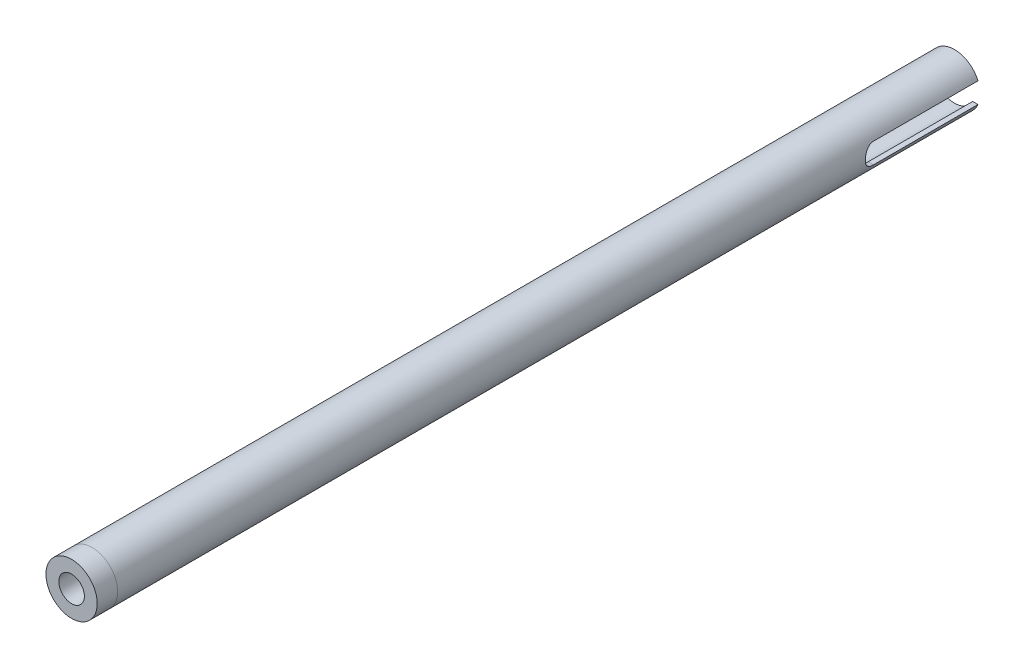
from build123d import *

# Parameters (mm, degrees)
THREADED_INSERT_1_1_DEPTH = 6.35
THREADED_START            = -6.35
THREADED_INSERT_1_2_DEPTH = 9.525
A_ARM_START               = -6.35
A_ARM_TUBE_DEPTH          = 267.13536
APEX_START                = -237.92536
APEX_SLOT_DEPTH           = 35.56
FILLET1_R                 = 3.175


with BuildPart() as part:
    # Sketch1 → Threaded insert 1-1 (new body)
    with BuildSketch(Plane.XY):
        with BuildLine():
            ThreePointArc((-2.38125, 3.175), (0, 3.96875), (2.38125, 3.175))
            Line((2.38125, 3.175), (5.630856905, 3.175))
            ThreePointArc((5.630856905, 3.175), (0, 6.4643), (-5.630856905, 3.175))
            Line((-5.630856905, 3.175), (-2.38125, 3.175))
        make_face()
        with BuildLine():
            ThreePointArc((-5.630856905, 3.175), (0, 6.4643), (5.630856905, 3.175))
            Line((5.630856905, 3.175), (7.274838916, 3.175))
            ThreePointArc((7.274838916, 3.175), (0, 7.9375), (-7.274838916, 3.175))
            Line((-7.274838916, 3.175), (-5.630856905, 3.175))
        make_face()
        with BuildLine():
            ThreePointArc((2.38125, 3.175), (3.549757914, 1.774878957), (3.96875, 0))
            Line((3.96875, 0), (6.4643, 0))
            ThreePointArc((6.4643, 0), (6.252468424, 1.641283978), (5.630856905, 3.175))
            Line((5.630856905, 3.175), (2.38125, 3.175))
        make_face()
        with BuildLine():
            Line((-6.4643, 0), (-3.96875, 0))
            ThreePointArc((-3.96875, 0), (-3.549757914, 1.774878957), (-2.38125, 3.175))
            Line((-2.38125, 3.175), (-5.630856905, 3.175))
            ThreePointArc((-5.630856905, 3.175), (-6.252468424, 1.641283978), (-6.4643, 0))
        make_face()
        with BuildLine():
            ThreePointArc((5.630856905, 3.175), (6.252468424, 1.641283978), (6.4643, 0))
            Line((6.4643, 0), (7.9375, 0))
            ThreePointArc((7.9375, 0), (7.770068859, 1.621707797), (7.274838916, 3.175))
            Line((7.274838916, 3.175), (5.630856905, 3.175))
        make_face()
        with BuildLine():
            Line((-7.9375, 0), (-6.4643, 0))
            ThreePointArc((-6.4643, 0), (-6.252468424, 1.641283978), (-5.630856905, 3.175))
            Line((-5.630856905, 3.175), (-7.274838916, 3.175))
            ThreePointArc((-7.274838916, 3.175), (-7.770068859, 1.621707797), (-7.9375, 0))
        make_face()
        with BuildLine():
            Line((7.9375, 0), (6.4643, 0))
            ThreePointArc((6.4643, 0), (6.252468424, -1.641283978), (5.630856905, -3.175))
            Line((5.630856905, -3.175), (7.274838916, -3.175))
            ThreePointArc((7.274838916, -3.175), (7.770068859, -1.621707797), (7.9375, 0))
        make_face()
        with BuildLine():
            ThreePointArc((-5.630856905, -3.175), (-6.252468424, -1.641283978), (-6.4643, 0))
            Line((-6.4643, 0), (-7.9375, 0))
            ThreePointArc((-7.9375, 0), (-7.770068859, -1.621707797), (-7.274838916, -3.175))
            Line((-7.274838916, -3.175), (-5.630856905, -3.175))
        make_face()
        with BuildLine():
            Line((6.4643, 0), (3.96875, 0))
            ThreePointArc((3.96875, 0), (3.549757914, -1.774878957), (2.38125, -3.175))
            Line((2.38125, -3.175), (5.630856905, -3.175))
            ThreePointArc((5.630856905, -3.175), (6.252468424, -1.641283978), (6.4643, 0))
        make_face()
        with BuildLine():
            ThreePointArc((-2.38125, -3.175), (-3.549757914, -1.774878957), (-3.96875, 0))
            Line((-3.96875, 0), (-6.4643, 0))
            ThreePointArc((-6.4643, 0), (-6.252468424, -1.641283978), (-5.630856905, -3.175))
            Line((-5.630856905, -3.175), (-2.38125, -3.175))
        make_face()
        with BuildLine():
            Line((5.630856905, -3.175), (2.38125, -3.175))
            ThreePointArc((2.38125, -3.175), (0, -3.96875), (-2.38125, -3.175))
            Line((-2.38125, -3.175), (-5.630856905, -3.175))
            ThreePointArc((-5.630856905, -3.175), (0, -6.4643), (5.630856905, -3.175))
        make_face()
        with BuildLine():
            Line((7.274838916, -3.175), (5.630856905, -3.175))
            ThreePointArc((5.630856905, -3.175), (0, -6.4643), (-5.630856905, -3.175))
            Line((-5.630856905, -3.175), (-7.274838916, -3.175))
            ThreePointArc((-7.274838916, -3.175), (0, -7.9375), (7.274838916, -3.175))
        make_face()
    extrude(amount=-THREADED_INSERT_1_1_DEPTH)

    # Sketch1<3> → Threaded insert 1-2 (add)
    with BuildSketch(Plane.XY.offset(THREADED_START)):
        with BuildLine():
            ThreePointArc((-2.38125, 3.175), (0, 3.96875), (2.38125, 3.175))
            Line((2.38125, 3.175), (5.630856905, 3.175))
            ThreePointArc((5.630856905, 3.175), (0, 6.4643), (-5.630856905, 3.175))
            Line((-5.630856905, 3.175), (-2.38125, 3.175))
        make_face()
        with BuildLine():
            ThreePointArc((2.38125, 3.175), (3.549757914, 1.774878957), (3.96875, 0))
            Line((3.96875, 0), (6.4643, 0))
            ThreePointArc((6.4643, 0), (6.252468424, 1.641283978), (5.630856905, 3.175))
            Line((5.630856905, 3.175), (2.38125, 3.175))
        make_face()
        with BuildLine():
            Line((-6.4643, 0), (-3.96875, 0))
            ThreePointArc((-3.96875, 0), (-3.549757914, 1.774878957), (-2.38125, 3.175))
            Line((-2.38125, 3.175), (-5.630856905, 3.175))
            ThreePointArc((-5.630856905, 3.175), (-6.252468424, 1.641283978), (-6.4643, 0))
        make_face()
        with BuildLine():
            Line((6.4643, 0), (3.96875, 0))
            ThreePointArc((3.96875, 0), (3.549757914, -1.774878957), (2.38125, -3.175))
            Line((2.38125, -3.175), (5.630856905, -3.175))
            ThreePointArc((5.630856905, -3.175), (6.252468424, -1.641283978), (6.4643, 0))
        make_face()
        with BuildLine():
            ThreePointArc((-2.38125, -3.175), (-3.549757914, -1.774878957), (-3.96875, 0))
            Line((-3.96875, 0), (-6.4643, 0))
            ThreePointArc((-6.4643, 0), (-6.252468424, -1.641283978), (-5.630856905, -3.175))
            Line((-5.630856905, -3.175), (-2.38125, -3.175))
        make_face()
        with BuildLine():
            Line((5.630856905, -3.175), (2.38125, -3.175))
            ThreePointArc((2.38125, -3.175), (0, -3.96875), (-2.38125, -3.175))
            Line((-2.38125, -3.175), (-5.630856905, -3.175))
            ThreePointArc((-5.630856905, -3.175), (0, -6.4643), (5.630856905, -3.175))
        make_face()
    extrude(amount=-THREADED_INSERT_1_2_DEPTH)


with BuildPart() as body_2:
    # Sketch1<4> → A-arm tube (new body)
    with BuildSketch(Plane.XY.offset(A_ARM_START)):
        with BuildLine():
            ThreePointArc((-5.630856905, 3.175), (0, 6.4643), (5.630856905, 3.175))
            Line((5.630856905, 3.175), (7.274838916, 3.175))
            ThreePointArc((7.274838916, 3.175), (0, 7.9375), (-7.274838916, 3.175))
            Line((-7.274838916, 3.175), (-5.630856905, 3.175))
        make_face()
        with BuildLine():
            ThreePointArc((5.630856905, 3.175), (6.252468424, 1.641283978), (6.4643, 0))
            Line((6.4643, 0), (7.9375, 0))
            ThreePointArc((7.9375, 0), (7.770068859, 1.621707797), (7.274838916, 3.175))
            Line((7.274838916, 3.175), (5.630856905, 3.175))
        make_face()
        with BuildLine():
            Line((-7.9375, 0), (-6.4643, 0))
            ThreePointArc((-6.4643, 0), (-6.252468424, 1.641283978), (-5.630856905, 3.175))
            Line((-5.630856905, 3.175), (-7.274838916, 3.175))
            ThreePointArc((-7.274838916, 3.175), (-7.770068859, 1.621707797), (-7.9375, 0))
        make_face()
        with BuildLine():
            Line((7.9375, 0), (6.4643, 0))
            ThreePointArc((6.4643, 0), (6.252468424, -1.641283978), (5.630856905, -3.175))
            Line((5.630856905, -3.175), (7.274838916, -3.175))
            ThreePointArc((7.274838916, -3.175), (7.770068859, -1.621707797), (7.9375, 0))
        make_face()
        with BuildLine():
            ThreePointArc((-5.630856905, -3.175), (-6.252468424, -1.641283978), (-6.4643, 0))
            Line((-6.4643, 0), (-7.9375, 0))
            ThreePointArc((-7.9375, 0), (-7.770068859, -1.621707797), (-7.274838916, -3.175))
            Line((-7.274838916, -3.175), (-5.630856905, -3.175))
        make_face()
        with BuildLine():
            Line((7.274838916, -3.175), (5.630856905, -3.175))
            ThreePointArc((5.630856905, -3.175), (0, -6.4643), (-5.630856905, -3.175))
            Line((-5.630856905, -3.175), (-7.274838916, -3.175))
            ThreePointArc((-7.274838916, -3.175), (0, -7.9375), (7.274838916, -3.175))
        make_face()
    extrude(amount=-A_ARM_TUBE_DEPTH)

    # Sketch1<5> → Apex slot (cut)
    with BuildSketch(Plane.XY.offset(APEX_START)):
        with BuildLine():
            ThreePointArc((5.630856905, 3.175), (6.252468424, 1.641283978), (6.4643, 0))
            Line((6.4643, 0), (7.9375, 0))
            ThreePointArc((7.9375, 0), (7.770068859, 1.621707797), (7.274838916, 3.175))
            Line((7.274838916, 3.175), (5.630856905, 3.175))
        make_face()
        with BuildLine():
            Line((-7.9375, 0), (-6.4643, 0))
            ThreePointArc((-6.4643, 0), (-6.252468424, 1.641283978), (-5.630856905, 3.175))
            Line((-5.630856905, 3.175), (-7.274838916, 3.175))
            ThreePointArc((-7.274838916, 3.175), (-7.770068859, 1.621707797), (-7.9375, 0))
        make_face()
        with BuildLine():
            Line((7.9375, 0), (6.4643, 0))
            ThreePointArc((6.4643, 0), (6.252468424, -1.641283978), (5.630856905, -3.175))
            Line((5.630856905, -3.175), (7.274838916, -3.175))
            ThreePointArc((7.274838916, -3.175), (7.770068859, -1.621707797), (7.9375, 0))
        make_face()
        with BuildLine():
            ThreePointArc((-5.630856905, -3.175), (-6.252468424, -1.641283978), (-6.4643, 0))
            Line((-6.4643, 0), (-7.9375, 0))
            ThreePointArc((-7.9375, 0), (-7.770068859, -1.621707797), (-7.274838916, -3.175))
            Line((-7.274838916, -3.175), (-5.630856905, -3.175))
        make_face()
    extrude(amount=-APEX_SLOT_DEPTH, mode=Mode.SUBTRACT)

    # Fillet1
    # the kernel refuses this fillet: 3.175 mm, written as the material it adds along each edge
    with BuildSketch(Plane(origin=(2.306643095, 3.175, -237.92536), x_dir=(0, 0, -1), z_dir=(-1, 0, 0))) as fillet1_piece_1_section:
        with BuildLine():
            CenterArc((FILLET1_R, FILLET1_R), FILLET1_R, 180, 90)
            Line((0, FILLET1_R), (0, 0))
            Line((0, 0), (FILLET1_R, 0))
        make_face()
    fillet1_piece_1 = extrude(amount=17.51898201, mode=Mode.PRIVATE)
    fillet1_piece_1 = fillet1_piece_1 - Plane(origin=(0, 0, -238.64509262), x_dir=(-0.8710698614669244, 0.49115913555994567, 0), z_dir=(0, 0, 1)) * Cylinder(6.4643, 48, mode=Mode.PRIVATE)
    fillet1_piece_1 = fillet1_piece_1 & Plane(origin=(0, 0, -238.64509262), x_dir=(-1, 0, 0), z_dir=(0, 0, 1)) * Cylinder(7.9375, 48, mode=Mode.PRIVATE)
    add(fillet1_piece_1)
    with BuildSketch(Plane(origin=(-15.212338916, -3.175, -237.92536), x_dir=(0, 0, -1), z_dir=(1, 0, 0))) as fillet1_piece_2_section:
        with BuildLine():
            CenterArc((FILLET1_R, FILLET1_R), FILLET1_R, 180, 90)
            Line((0, FILLET1_R), (0, 0))
            Line((0, 0), (FILLET1_R, 0))
        make_face()
    fillet1_piece_2 = extrude(amount=17.51898201, mode=Mode.PRIVATE)
    fillet1_piece_2 = fillet1_piece_2 - Plane(origin=(0, 0, -238.645092783), x_dir=(-0.8710698614669244, 0.49115913555994567, 0), z_dir=(0, 0, 1)) * Cylinder(6.4643, 48, mode=Mode.PRIVATE)
    fillet1_piece_2 = fillet1_piece_2 & Plane(origin=(0, 0, -238.645092783), x_dir=(-1, 0, 0), z_dir=(0, 0, 1)) * Cylinder(7.9375, 48, mode=Mode.PRIVATE)
    add(fillet1_piece_2)
    with BuildSketch(Plane(origin=(-2.306643095, -3.175, -237.92536), x_dir=(0, 0, -1), z_dir=(1, 0, 0))) as fillet1_piece_3_section:
        with BuildLine():
            CenterArc((FILLET1_R, FILLET1_R), FILLET1_R, 180, 90)
            Line((0, FILLET1_R), (0, 0))
            Line((0, 0), (FILLET1_R, 0))
        make_face()
    fillet1_piece_3 = extrude(amount=17.51898201, mode=Mode.PRIVATE)
    fillet1_piece_3 = fillet1_piece_3 - Plane(origin=(0, 0, -238.64509262), x_dir=(-0.8710698614669244, 0.49115913555994567, 0), z_dir=(0, 0, 1)) * Cylinder(6.4643, 48, mode=Mode.PRIVATE)
    fillet1_piece_3 = fillet1_piece_3 & Plane(origin=(0, 0, -238.64509262), x_dir=(-1, 0, 0), z_dir=(0, 0, 1)) * Cylinder(7.9375, 48, mode=Mode.PRIVATE)
    add(fillet1_piece_3)
    with BuildSketch(Plane(origin=(15.212338916, 3.175, -237.92536), x_dir=(0, -1, 0), z_dir=(-1, 0, 0))) as fillet1_piece_4_section:
        with BuildLine():
            CenterArc((FILLET1_R, -FILLET1_R), FILLET1_R, 90, 90)
            Line((0, -FILLET1_R), (0, 0))
            Line((0, 0), (FILLET1_R, 0))
        make_face()
    fillet1_piece_4 = extrude(amount=17.51898201, mode=Mode.PRIVATE)
    fillet1_piece_4 = fillet1_piece_4 - Plane(origin=(0, 0, -238.645092609), x_dir=(-0.8710698614669244, 0.49115913555994567, 0), z_dir=(0, 0, 1)) * Cylinder(6.4643, 48, mode=Mode.PRIVATE)
    fillet1_piece_4 = fillet1_piece_4 & Plane(origin=(0, 0, -238.645092609), x_dir=(-1, 0, 0), z_dir=(0, 0, 1)) * Cylinder(7.9375, 48, mode=Mode.PRIVATE)
    add(fillet1_piece_4)


solid = Compound([part.part, body_2.part])
